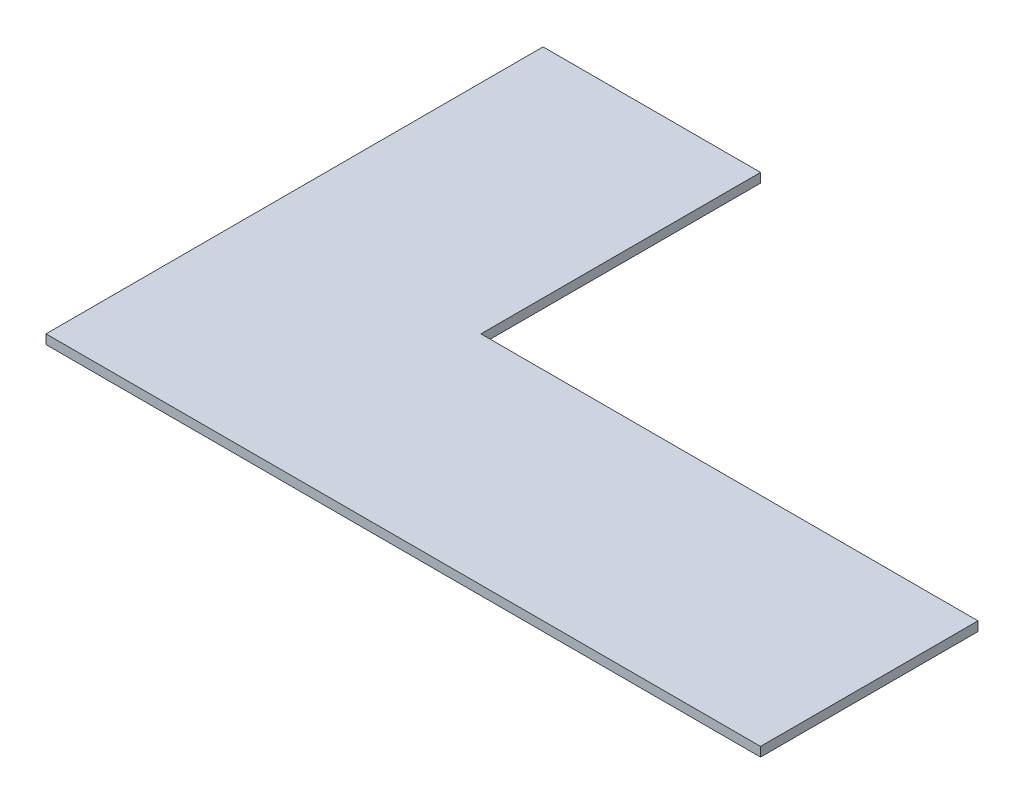
from build123d import *

# Parameters (mm, degrees)
BOSS_EXTRUDE1_DEPTH = 3


with BuildPart() as part:
    # Sketch1 → Boss-Extrude1 (new body)
    with BuildSketch(Plane(origin=(0, 0, 0), x_dir=(1, 0, 0), z_dir=(0, 1, 0))):
        Polygon((-115, -35), (115, -35), (115, 35), (-45, 35), (-45, 125), (-115, 125), (-115, 35), align=None)
    extrude(amount=BOSS_EXTRUDE1_DEPTH)


solid = part.part
